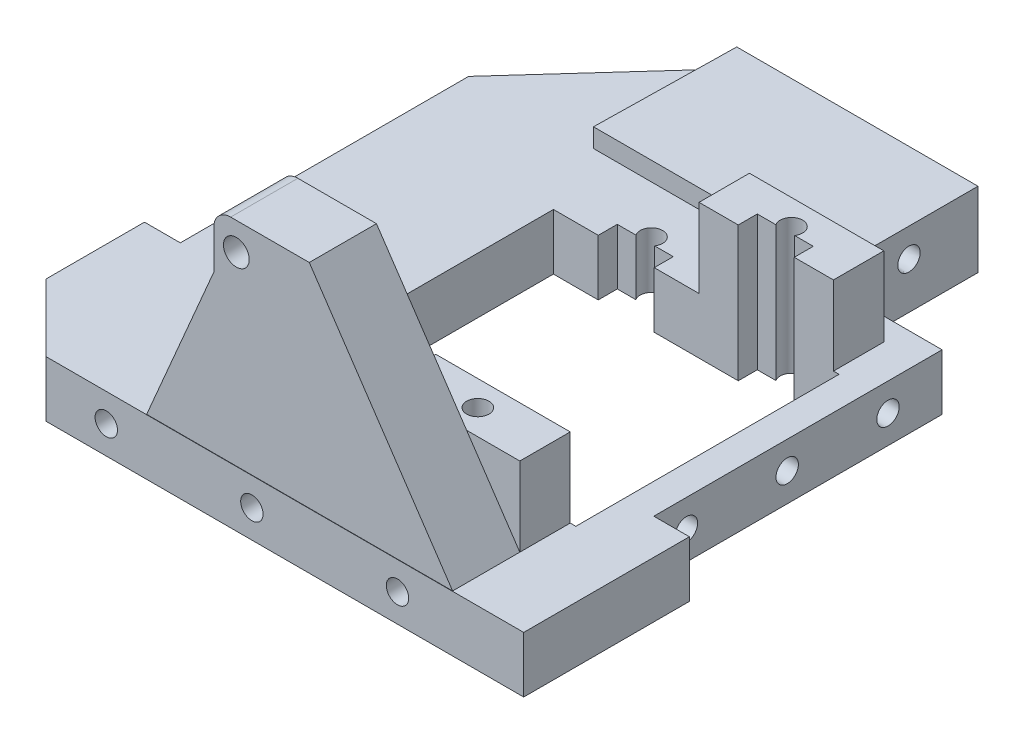
from build123d import *

# Parameters (mm, degrees)
EXTRUDE_1_DEPTH     = 5
SKETCH_4_R          = 0.999999968
SKETCH_4_R_2        = 1.000000188
CUT_EXTRUDE_1_DEPTH = 5
SKETCH_6_R          = 1.000000276
SKETCH_6_R_2        = 0.999999818
CUT_EXTRUDE_2_DEPTH = 5
EXTRUDE_2_DEPTH     = 7.05
SKETCH_10_R         = 1.149999964
EXTRUDE_3_DEPTH     = 6
EXTRUDE_4_DEPTH     = 1.68
SKETCH_13_R         = 1.000000021
SKETCH_13_R_2       = 0.999999728
SKETCH_13_R_3       = 0.999999832
CUT_EXTRUDE_3_DEPTH = 6
SKETCH_16_R         = 1.000000053
SKETCH_16_R_2       = 1.000000005
CUT_EXTRUDE_4_DEPTH = 8
SKETCH_18_R         = 1.000000534
SKETCH_18_R_2       = 1.000000046
SKETCH_18_R_3       = 0.999998785
CUT_EXTRUDE_5_DEPTH = 3.5
CUT_EXTRUDE_6_REACH = 82.071
SKETCH_20_R         = 1.000000734
SKETCH_23_R         = 0.999998521
SKETCH_23_R_2       = 0.99999884
SKETCH_23_R_3       = 0.999998599
CUT_EXTRUDE_7_DEPTH = 12


with BuildPart() as part:
    # 草图2 → 凸台-拉伸1 (new body)
    with BuildSketch(Plane(origin=(0, 0, 0), x_dir=(1, 0, 0), z_dir=(0, 1, 0))):
        Polygon((-16.950000763, 14.201086044), (25.699960709, 14.201086044), (25.699960709, 28.992816925), (22.523960114, 28.992816925), (22.523960114, 54.730998993), (13.161137581, 54.730880737), (13.161137581, 67.299995422), (-8.376040459, 67.299995422), (-19.75, 54.730998993), (-19.75, 28.992816925), (-22.950000763, 28.992816925), (-22.950000763, 20.201086044), align=None)
    extrude(amount=EXTRUDE_1_DEPTH)

    # 草图4 → 切除-拉伸1 (cut)
    with BuildSketch(Plane.XZ):
        with Locations((0.823959914, -22.48135431)):
            Circle(SKETCH_4_R)
        with Locations((13.323959603, -22.481354784)):
            Circle(SKETCH_4_R_2)
        Polygon((-5.676040173, -24.73135376), (19.823959351, -24.73135376), (19.823959351, -48.23135376), (15.823960304, -48.23135376), (15.823960304, -49.931354523), (10.823960304, -49.931354523), (10.823960304, -48.23135376), (3.323960066, -48.23135376), (3.323960066, -49.931354523), (-1.676040053, -49.931354523), (-1.676040053, -48.23135376), (-5.676040173, -48.23135376), align=None)
    extrude(amount=-CUT_EXTRUDE_1_DEPTH, mode=Mode.SUBTRACT)

    # 草图6 → 切除-拉伸2 (cut)
    with BuildSketch(Plane.XZ):
        with Locations((0.823959833, -50.481354106)):
            Circle(SKETCH_6_R)
        with Locations((13.323959879, -50.481354301)):
            Circle(SKETCH_6_R_2)
    extrude(amount=-CUT_EXTRUDE_2_DEPTH, mode=Mode.SUBTRACT)

    # 草图7 → 凸台-拉伸2 (add)
    # profile 1 of 2: a face of its own
    with BuildSketch(Plane(origin=(0, 5, 0), x_dir=(1, 0, 0), z_dir=(0, 1, 0))):
        with BuildLine():
            Line((19.323960304, 48.23135376), (19.323960304, 52.73135376))
            Line((19.323960304, 52.73135376), (7.323960304, 52.73135376))
            Line((7.323960304, 52.73135376), (7.323960304, 48.23135376))
            Line((7.323960304, 48.23135376), (10.823960304, 48.23135376))
            Line((10.823960304, 48.23135376), (10.823960304, 49.931354523))
            Line((10.823960304, 49.931354523), (12.488795296, 49.931354523))
            ThreePointArc((12.488795296, 49.931354523), (13.323959879, 51.481347504), (14.159124462, 49.931354523))
            Line((14.159124462, 49.931354523), (15.823960304, 49.931354523))
            Line((15.823960304, 49.931354523), (15.823960304, 48.23135376))
            Line((15.823960304, 48.23135376), (19.323960304, 48.23135376))
        make_face()
    # profile 2 of 2: a face of its own
    with BuildSketch(Plane(origin=(0, 5, 0), x_dir=(1, 0, 0), z_dir=(0, 1, 0))):
        Polygon((15.823960304, 24.73135376), (19.323960304, 24.73135376), (19.323960304, 20.23135376), (7.323960304, 20.23135376), (7.323960304, 24.73135376), align=None)
        with BuildLine():
            ThreePointArc((14.159124462, 23.031352997), (13.323959879, 21.481360016), (12.488795296, 23.031352997))
            ThreePointArc((12.488795296, 23.031352997), (13.323959879, 23.481354957), (14.159124462, 23.031352997))
        make_face(mode=Mode.SUBTRACT)
    extrude(amount=EXTRUDE_2_DEPTH)

    # 草图10 → 凸台-拉伸3 (add)
    with BuildSketch(Plane.XY.offset(-20.23135376)):
        with BuildLine():
            Line((-1.994003773, 18.999999523), (-7.99400425, 5))
            Line((-7.99400425, 5), (19.323960304, 5))
            Line((19.323960304, 5), (6.523961067, 23.999999285))
            Line((6.523961067, 23.999999285), (-0.494003773, 23.999999285))
            ThreePointArc((-0.494003773, 23.999999285), (-1.554663945, 23.560659457), (-1.994003773, 22.499999285))
            Line((-1.994003773, 22.499999285), (-1.994003773, 18.999999523))
        make_face()
        with Locations((0.012219402, 21.535050796)):
            Circle(SKETCH_10_R, mode=Mode.SUBTRACT)
    extrude(amount=EXTRUDE_3_DEPTH)

    # 草图11 → 凸台-拉伸4 (add)
    with BuildSketch(Plane(origin=(0, 5, 0), x_dir=(1, 0, 0), z_dir=(0, 1, 0))):
        Polygon((13.161137581, 67.299995422), (13.161137581, 54.730880737), (-8.60142277, 54.730880737), (-8.376040459, 67.299995422), align=None)
    extrude(amount=EXTRUDE_4_DEPTH)

    # 草图13 → 切除-拉伸3 (cut)
    with BuildSketch(Plane.XY.offset(-14.201086044)):
        with Locations((1.43202298, 2.499998854)):
            Circle(SKETCH_13_R)
        with Locations((14.432022776, 2.500426737)):
            Circle(SKETCH_13_R_2)
        with Locations((-11.56797721, 2.500425343)):
            Circle(SKETCH_13_R_3)
    extrude(amount=-CUT_EXTRUDE_3_DEPTH, mode=Mode.SUBTRACT)

    # 草图16 → 切除-拉伸4 (cut)
    with BuildSketch(Plane(origin=(0, 0, -67.299995422), x_dir=(-1, 0, 0), z_dir=(0, 0, -1))):
        with Locations((2.838862252, 3.341525112)):
            Circle(SKETCH_16_R)
        with Locations((-8.161137581, 3.341525112)):
            Circle(SKETCH_16_R_2)
    extrude(amount=-CUT_EXTRUDE_4_DEPTH, mode=Mode.SUBTRACT)

    # 草图18 → 切除-拉伸5 (cut)
    with BuildSketch(Plane(origin=(22.523960114, 0, 0), x_dir=(0, 0, -1), z_dir=(1, 0, 0))):
        with Locations((31.901501235, 2.515246467)):
            Circle(SKETCH_18_R)
        with Locations((40.901397751, 2.558118146)):
            Circle(SKETCH_18_R_2)
        with Locations((49.901297308, 2.515242677)):
            Circle(SKETCH_18_R_3)
    extrude(amount=-CUT_EXTRUDE_5_DEPTH, mode=Mode.SUBTRACT)

    # 切除-拉伸6: up to this plane
    cut_extrude_6_end = Plane(origin=(-8.376040459, 6.68, -67.299995422), z_dir=(0.9998392705101669, 0, 0.01792855670982644))
    # 草图20 → 切除-拉伸6 (cut, up to the surface)
    with BuildSketch(Plane(origin=(13.161137581, 0, 0), x_dir=(0, 0, -1), z_dir=(1, 0, 0)), mode=Mode.PRIVATE) as cut_extrude_6_sk1:
        with Locations((61.138572163, 4.131263563)):
            Circle(SKETCH_20_R)
    cut_extrude_6_tool1 = split(extrude(cut_extrude_6_sk1.sketch, amount=CUT_EXTRUDE_6_REACH, dir=(-0.99983927051, 0, -0.01792855671), mode=Mode.PRIVATE), bisect_by=cut_extrude_6_end, keep=Keep.BOTH, mode=Mode.PRIVATE)
    add(cut_extrude_6_tool1.solids().sort_by_distance((13.161138, 4.131264, -61.138572))[0], mode=Mode.SUBTRACT)

    # 草图23 → 切除-拉伸7 (cut)
    with BuildSketch(Plane.ZY.offset(19.75)):
        with Locations((-31.900998993, 2.5)):
            Circle(SKETCH_23_R)
        with Locations((-40.900998993, 2.5)):
            Circle(SKETCH_23_R_2)
        with Locations((-49.900998993, 2.5)):
            Circle(SKETCH_23_R_3)
    extrude(amount=-CUT_EXTRUDE_7_DEPTH, mode=Mode.SUBTRACT)


solid = part.part
